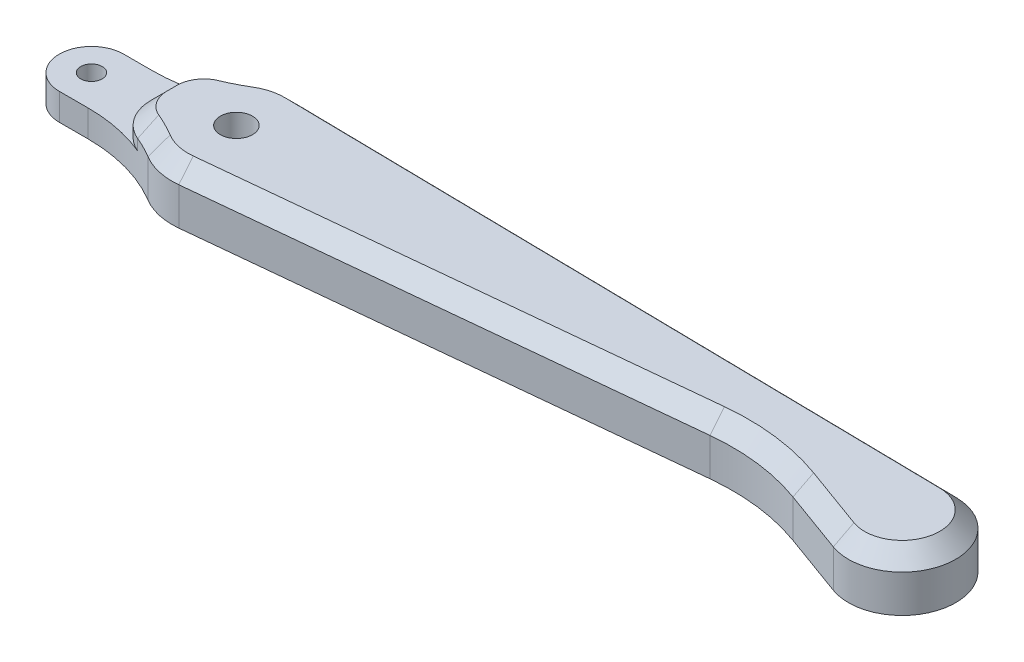
from build123d import *

# Parameters (mm, degrees)
SKETCH1_R           = 1.5
SKETCH1_R_2         = 1
BOSS_EXTRUDE1_DEPTH = 5
FILLET1_R           = 20
CUT_EXTRUDE1_START  = -2.5
CUT_EXTRUDE1_DEPTH  = 2.5
FILLET5_R           = 15
FILLET6_R           = 4
CHAMFER1_SIZE       = 1.5


with BuildPart() as part:
    # Sketch1 → Boss-Extrude1 (new body)
    with BuildSketch(Plane(origin=(0, 0, 0), x_dir=(1, 0, 0), z_dir=(0, 1, 0))):
        with BuildLine():
            Line((0.6, -5.969924623), (50.1, -0.994987437))
            Line((50.1, -0.994987437), (60.292075574, -4.699254638))
            ThreePointArc((60.292075574, -4.699254638), (66.917086627, -0.906785038), (62.080644677, 4.999349601))
            Line((62.080644677, 4.999349601), (0.105263158, 5.999076568))
            ThreePointArc((0.105263158, 5.999076568), (-2.95430253, 5.222269292), (-5.196152423, 3))
            Line((-5.196152423, 3), (-13.5, 3))
            ThreePointArc((-13.5, 3), (-16.5, 0), (-13.5, -3))
            Line((-13.5, -3), (-5.196152423, -3))
            ThreePointArc((-5.196152423, -3), (-2.736104409, -5.339825153), (0.6, -5.969924623))
        make_face()
        with Locations(Location((0, 0, 0), (0, 0, 270))):
            Circle(SKETCH1_R, mode=Mode.SUBTRACT)
        with Locations(Location((-13.5, 0, 0), (0, 0, 270))):
            Circle(SKETCH1_R_2, mode=Mode.SUBTRACT)
    extrude(amount=BOSS_EXTRUDE1_DEPTH)

    # Fillet1
    fillet1_edges = [part.edges().sort_by_distance(p)[0] for p in [
        (50.1, 2.5, 0.994987437),
    ]]
    fillet(fillet1_edges, radius=FILLET1_R)

    # Sketch2 → Cut-Extrude1 (cut)
    with BuildSketch(Plane(origin=(0, 5, 0), x_dir=(1, 0, 0), z_dir=(0, 1, 0)).offset(CUT_EXTRUDE1_START)):
        with BuildLine():
            Line((-13.5, 3), (-7.5, 3))
            Line((-7.5, 3), (-7.5, -3))
            Line((-7.5, -3), (-13.5, -3))
            ThreePointArc((-13.5, -3), (-16.5, 0), (-13.5, 3))
        make_face()
    extrude(amount=CUT_EXTRUDE1_DEPTH, mode=Mode.SUBTRACT)

    # Fillet5
    # the kernel refuses this fillet: 15 mm, written as the material it adds along each edge
    with BuildSketch(Plane(origin=(-5.196152423, 0, 3), x_dir=(0.7008923394400669, 0, 0.7132670807728548), z_dir=(0, 1, 0))) as fillet5_piece_1_section:
        with BuildLine():
            CenterArc((6.759639834, -14.52230372), FILLET5_R, 104.498640433, 31.002719134)
            Line((-3.939366378, -4.008918629), (0, 0))
            ThreePointArc((0, 0), (1.502142185, -0.191078512), (3.004284371, 0))
        make_face()
    fillet5_piece_1 = extrude(amount=5, mode=Mode.PRIVATE)
    fillet5_piece_1 = split(fillet5_piece_1, bisect_by=Plane(origin=(-7.5, 1.25, 3.544303671), z_dir=(1, 0, 0)), keep=Keep.TOP, mode=Mode.PRIVATE)
    fillet5_piece_1 = split(fillet5_piece_1, bisect_by=Plane(origin=(-5.459248891, 2.5, 3.544303671), z_dir=(0, -1, 0)), keep=Keep.TOP, mode=Mode.PRIVATE)
    add(fillet5_piece_1)
    with BuildSketch(Plane(origin=(-5.196152423, 0, 3), x_dir=(0.7008923394400669, 0, 0.7132670807728548), z_dir=(0, 1, 0))) as fillet5_piece_2_section:
        with BuildLine():
            CenterArc((6.759639834, -14.52230372), FILLET5_R, 104.498640433, 31.002719134)
            Line((-3.939366378, -4.008918629), (0, 0))
            ThreePointArc((0, 0), (1.502142185, -0.191078512), (3.004284371, 0))
        make_face()
    fillet5_piece_2 = extrude(amount=5, mode=Mode.PRIVATE)
    fillet5_piece_2 = split(fillet5_piece_2, bisect_by=Plane(origin=(-7.5, 1.25, 2.925994162), z_dir=(-1, 0, 0)), keep=Keep.TOP, mode=Mode.PRIVATE)
    fillet5_piece_2 = split(fillet5_piece_2, bisect_by=Plane(origin=(-8.916431377, 2.5, 2.925994162), z_dir=(0, -1, 0)), keep=Keep.TOP, mode=Mode.PRIVATE)
    add(fillet5_piece_2)
    with BuildSketch(Plane(origin=(-5.196152423, 0, 3), x_dir=(0.7008923394400669, 0, 0.7132670807728548), z_dir=(0, 1, 0))) as fillet5_piece_3_section:
        with BuildLine():
            CenterArc((6.759639834, -14.52230372), FILLET5_R, 104.498640433, 31.002719134)
            Line((-3.939366378, -4.008918629), (0, 0))
            ThreePointArc((0, 0), (1.502142185, -0.191078512), (3.004284371, 0))
        make_face()
    fillet5_piece_3 = extrude(amount=5, mode=Mode.PRIVATE)
    fillet5_piece_3 = split(fillet5_piece_3, bisect_by=Plane(origin=(-7.5, 3.75, 3.544303671), z_dir=(1, 0, 0)), keep=Keep.TOP, mode=Mode.PRIVATE)
    fillet5_piece_3 = split(fillet5_piece_3, bisect_by=Plane(origin=(-5.459248891, 2.5, 3.544303671), z_dir=(0, 1, 0)), keep=Keep.TOP, mode=Mode.PRIVATE)
    add(fillet5_piece_3)
    with BuildSketch(Plane(origin=(-5.196152423, 0, -3), x_dir=(-1, 0, 0), z_dir=(0, 1, 0))) as fillet5_piece_4_section:
        with BuildLine():
            CenterArc((5.620501404, -15), FILLET5_R, 90, 31.002719134)
            ThreePointArc((-2.105679901, -2.142857143), (-0.916549938, -1.205354037), (0, 0))
            Line((0, 0), (5.620501404, 0))
        make_face()
    fillet5_piece_4 = extrude(amount=5, mode=Mode.PRIVATE)
    fillet5_piece_4 = split(fillet5_piece_4, bisect_by=Plane(origin=(-8.916431377, 2.5, -2.925994162), z_dir=(0, -1, 0)), keep=Keep.TOP, mode=Mode.PRIVATE)
    fillet5_piece_4 = split(fillet5_piece_4, bisect_by=Plane(origin=(-7.5, 1.25, -2.925994162), z_dir=(-1, 0, 0)), keep=Keep.TOP, mode=Mode.PRIVATE)
    add(fillet5_piece_4)
    with BuildSketch(Plane(origin=(-5.196152423, 0, -3), x_dir=(-1, 0, 0), z_dir=(0, 1, 0))) as fillet5_piece_5_section:
        with BuildLine():
            CenterArc((5.620501404, -15), FILLET5_R, 90, 31.002719134)
            ThreePointArc((-2.105679901, -2.142857143), (-0.916549938, -1.205354037), (0, 0))
            Line((0, 0), (5.620501404, 0))
        make_face()
    fillet5_piece_5 = extrude(amount=5, mode=Mode.PRIVATE)
    fillet5_piece_5 = split(fillet5_piece_5, bisect_by=Plane(origin=(-5.459248891, 2.5, -3.544303671), z_dir=(0, -1, 0)), keep=Keep.TOP, mode=Mode.PRIVATE)
    fillet5_piece_5 = split(fillet5_piece_5, bisect_by=Plane(origin=(-7.5, 1.25, -3.544303671), z_dir=(1, 0, 0)), keep=Keep.TOP, mode=Mode.PRIVATE)
    add(fillet5_piece_5)
    with BuildSketch(Plane(origin=(-5.196152423, 0, -3), x_dir=(-1, 0, 0), z_dir=(0, 1, 0))) as fillet5_piece_6_section:
        with BuildLine():
            CenterArc((5.620501404, -15), FILLET5_R, 90, 31.002719134)
            ThreePointArc((-2.105679901, -2.142857143), (-0.916549938, -1.205354037), (0, 0))
            Line((0, 0), (5.620501404, 0))
        make_face()
    fillet5_piece_6 = extrude(amount=5, mode=Mode.PRIVATE)
    fillet5_piece_6 = split(fillet5_piece_6, bisect_by=Plane(origin=(-5.459248891, 2.5, -3.544303671), z_dir=(0, 1, 0)), keep=Keep.TOP, mode=Mode.PRIVATE)
    fillet5_piece_6 = split(fillet5_piece_6, bisect_by=Plane(origin=(-7.5, 3.75, -3.544303671), z_dir=(1, 0, 0)), keep=Keep.TOP, mode=Mode.PRIVATE)
    add(fillet5_piece_6)

    # Fillet6
    fillet6_edges = [part.edges().sort_by_distance(p)[0] for p in [
        (-7.5, 3.75, 3.371267745),
        (-7.5, 3.75, -3.371267745),
    ]]
    fillet(fillet6_edges, radius=FILLET6_R)

    # Chamfer1
    chamfer1_edges = [part.edges().sort_by_distance(p)[0] for p in [
        (-4.047431746, 5, -4.614275051),
        (-6.828767993, 5, -2.683225442),
        (-7.5, 5, 0),
        (-6.828767993, 5, 2.683225442),
        (-4.047431746, 5, 4.614275051),
        (-1.312106512, 5, 5.854773821),
        (23.079157013, 5, 3.710684337),
        (50.036282779, 5, 1.505294708),
        (57.341043652, 5, 3.62671444),
        (66.917086627, 5, 0.906785038),
        (31.092953917, 5, -5.499213085),
        (-1.552786741, 5, -5.795589128),
    ]]
    chamfer(chamfer1_edges, length=CHAMFER1_SIZE)


solid = part.part
